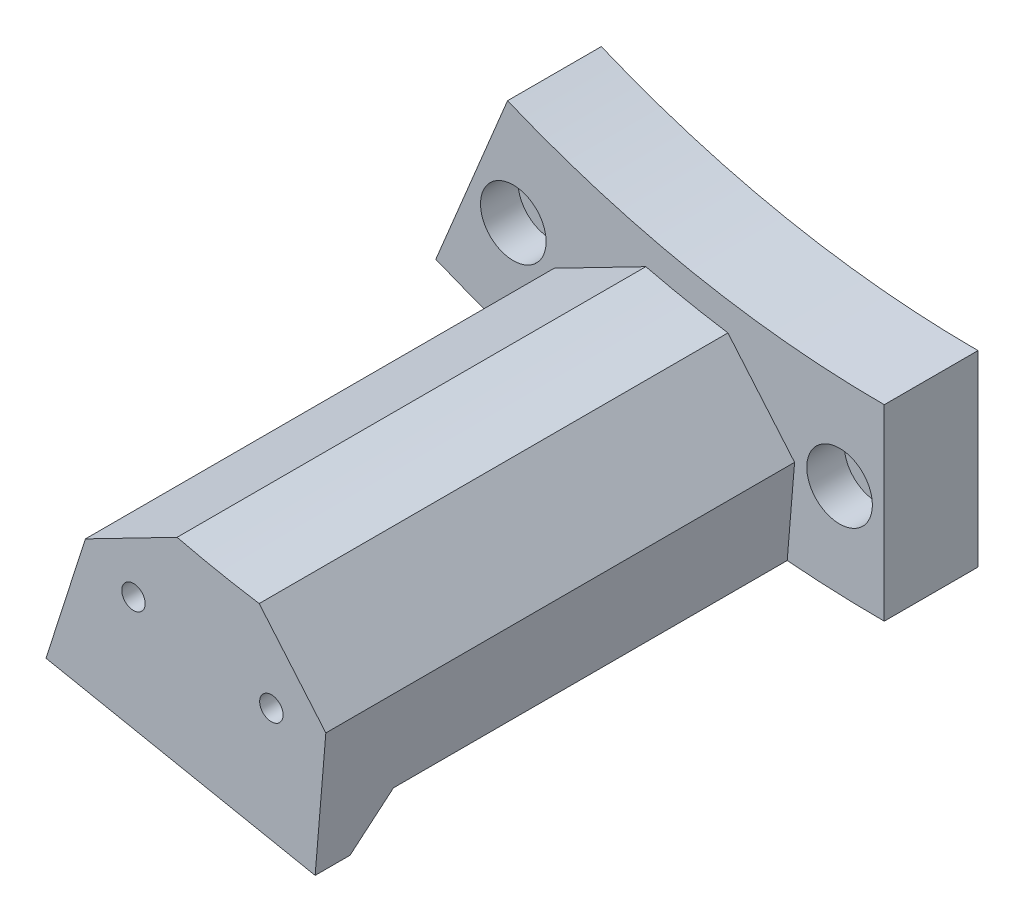
from build123d import *

# Parameters (mm, degrees)
BOSS_EXTRU_1_DEPTH      = 10
BOSS_EXTRU_2_DEPTH      = 48
BOSS_EXTRU_3_DEPTH      = 2
CHANFREIN1_SIZE         = 6
ENL_V_MAT_EXTRU_1_REACH = 148.244
ESQUISSE5_R             = 1.75
ESQUISSE6_R             = 3.5
ENL_V_MAT_EXTRU_2_DEPTH = 4
CHANFREIN2_SIZE         = 7.5
ESQUISSE7_R             = 1.25
ENL_V_MAT_EXTRU_3_DEPTH = 10


with BuildPart() as part:
    # Esquisse1 → Boss.-Extru.1 (new body)
    with BuildSketch(Plane.XY):
        with BuildLine():
            Line((-40.181760398, -97.007350914), (-47.835429046, -115.484941564))
            ThreePointArc((-47.835429046, -115.484941564), (-24.386290252, -122.59816005), (0, -125))
            Line((0, -125), (0, -105))
            ThreePointArc((0, -105), (-20.484483812, -102.982454442), (-40.181760398, -97.007350914))
        make_face()
    extrude(amount=BOSS_EXTRU_1_DEPTH)

    # Esquisse2 → Boss.-Extru.2 (add)
    with BuildSketch(Plane.XY.offset(10)):
        with BuildLine():
            Line((-32.925344295, -102.858746361), (-38.108037379, -119.049474955))
            ThreePointArc((-38.108037379, -119.049474955), (-24.386290252, -122.59816005), (-10.351025939, -124.570687812))
            Line((-10.351025939, -124.570687812), (-8.943286411, -107.62907427))
            ThreePointArc((-8.943286411, -107.62907427), (-21.069754778, -105.924810284), (-32.925344295, -102.858746361))
        make_face()
    extrude(amount=BOSS_EXTRU_2_DEPTH)

    # Esquisse4 → Boss.-Extru.3 (add)
    with BuildSketch(Plane.XY.offset(58)):
        with BuildLine():
            Line((-39.413172773, -123.12671677), (-10.705530953, -128.837021766))
            Line((-10.705530953, -128.837021766), (-8.943286411, -107.62907427))
            ThreePointArc((-8.943286411, -107.62907427), (-21.069754778, -105.924810284), (-32.925344295, -102.858746361))
            Line((-32.925344295, -102.858746361), (-39.413172773, -123.12671677))
        make_face()
    extrude(amount=BOSS_EXTRU_3_DEPTH)

    # Chanfrein1
    # the kernel refuses this chamfer: 6 mm, written as the material it adds along each edge
    with BuildSketch(Plane(origin=(0, 0, 58), x_dir=(-0.3048642990280114, -0.9523957996432781, 0), z_dir=(-0.9523957996432781, 0.3048642990280114, 0))) as chanfrein1_piece_1_section:
        Polygon((125 + CHANFREIN1_SIZE, 0), (125, -CHANFREIN1_SIZE), (125, 0), align=None)
    chanfrein1_piece_1 = revolve(axis=Axis((0, 0, 58), (0, 0, 1)), revolution_arc=13, mode=Mode.PRIVATE)
    chanfrein1_piece_1 = split(chanfrein1_piece_1, bisect_by=Plane(origin=(-25.059351863, -125.981869268, 58), z_dir=(0.19509032201612828, 0.9807852804032304, 0)), keep=Keep.TOP, mode=Mode.PRIVATE)
    add(chanfrein1_piece_1)

    # Esquisse5 → Enlèv. mat.-Extru.1 (cut, up to next)
    with BuildSketch(Plane.XY.offset(10), mode=Mode.PRIVATE) as enl_v_mat_extru_1_sk1:
        with Locations((-4.765565521, -114.901215769)):
            Circle(ESQUISSE5_R)
    enl_v_mat_extru_1_tool1 = extrude(enl_v_mat_extru_1_sk1.sketch, amount=-ENL_V_MAT_EXTRU_1_REACH, mode=Mode.PRIVATE) & part.part
    # Esquisse5 → Enlèv. mat.-Extru.1 (cut, up to next)
    with BuildSketch(Plane.XY.offset(10), mode=Mode.PRIVATE) as enl_v_mat_extru_1_sk2:
        with Locations((-39.567983188, -107.978584481)):
            Circle(ESQUISSE5_R)
    enl_v_mat_extru_1_tool2 = extrude(enl_v_mat_extru_1_sk2.sketch, amount=-ENL_V_MAT_EXTRU_1_REACH, mode=Mode.PRIVATE) & part.part
    add(enl_v_mat_extru_1_tool1.solids().sort_by_distance((-4.765566, -114.901216, 10))[0], mode=Mode.SUBTRACT)
    add(enl_v_mat_extru_1_tool2.solids().sort_by_distance((-39.567983, -107.978584, 10))[0], mode=Mode.SUBTRACT)

    # Esquisse6 → Enlèv. mat.-Extru.2 (cut)
    with BuildSketch(Plane.XY.offset(10)):
        with Locations((-39.567983188, -107.978584481)):
            Circle(ESQUISSE6_R)
        with Locations((-4.765565521, -114.901215769)):
            Circle(ESQUISSE6_R)
    extrude(amount=-ENL_V_MAT_EXTRU_2_DEPTH, mode=Mode.SUBTRACT)

    # Chanfrein2
    # the kernel refuses this chamfer: 7.5 mm, written as the material it takes off along each edge
    with BuildSketch(Plane(origin=(-8.943286411, -107.62907427, 10), x_dir=(-0.08280820751335238, -0.996565502497666, 0), z_dir=(0, 0, 1)), Plane(origin=(-32.925344295, -102.858746361, 80.019854797), x_dir=(-0.3048642990290983, -0.9523957996429303, 0), z_dir=(0, 0, -1))) as chanfrein2_piece_1:
        with BuildLine():
            Line((CHANFREIN2_SIZE, 0), (-0.280634385, -7.780634385))
            ThreePointArc((-0.280634385, -7.780634385), (-0.074202159, -4.002769088), (0, 0))
            Line((0, 0), (CHANFREIN2_SIZE, 0))
        make_face()
    extrude(amount=70.019854797, mode=Mode.SUBTRACT)

    # Esquisse7 → Enlèv. mat.-Extru.3 (cut)
    with BuildSketch(Plane.XY.offset(60)):
        with Locations((-30.083912118, -112.798307752)):
            Circle(ESQUISSE7_R)
        with Locations((-15.372132912, -115.724662582)):
            Circle(ESQUISSE7_R)
    extrude(amount=-ENL_V_MAT_EXTRU_3_DEPTH, mode=Mode.SUBTRACT)


solid = part.part
